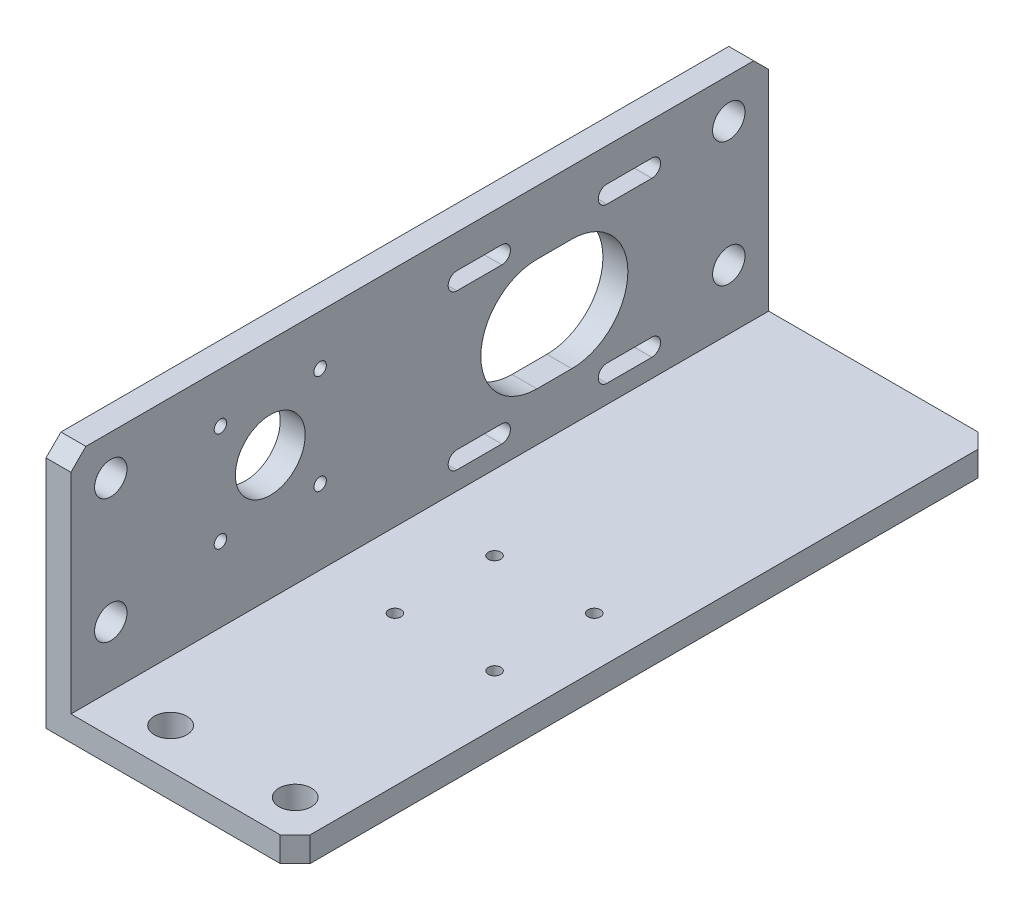
from build123d import *

# Parameters (mm, degrees)
ESTRUSIONE_ESTRUSIONE1_DEPTH = 140
FORO_6_5_6_5_1_D             = 6.5
FORO_6_5_6_5_2_AT_2_COUNT    = 2
FORO_6_5_6_5_2_AT_2_PITCH    = 25
TAGLIO_ESTRUSIONE2_REACH     = 158.844
SCHIZZO9_R                   = 7
TAGLIO_ESTRUSIONE4_REACH     = 158.844
SMUSSO1_SIZE                 = 3
M3_TAPPED_HOLE1_D            = 2.5
M3_TAPPED_HOLE2_D            = 2.5


with BuildPart() as part:
    # Schizzo1 → Estrusione-Estrusione1 (new body)
    with BuildSketch(Plane.XY):
        Polygon((0, 0), (0, 50), (5, 50), (5, 5), (50, 5), (50, 0), align=None)
    extrude(amount=ESTRUSIONE_ESTRUSIONE1_DEPTH)

    # Foro Ø6.5 (6.5)-1 (through all)
    with Locations(Plane(origin=(0, 0, 0), x_dir=(-1, 0, 0), z_dir=(0, -1, 0))):
        with Locations((-17, -132), (-42, -132)):
            Hole(FORO_6_5_6_5_1_D / 2)

    # Schizzo6 → Foro Ø6.5 (6.5)-2 (revolve, cut)
    with BuildSketch(Plane(origin=(0, 42, 132), x_dir=(0, 0, 1), z_dir=(0, 1, 0))):
        Polygon((0, 0), (0, 6.952797012), (3.25, 5), (3.25, 0), align=None)
    foro_6_5_6_5_2 = revolve(axis=Axis((-6.35, 42, 132), (1, 0, 0)), mode=Mode.SUBTRACT)

    # Foro Ø6.5 (6.5)-2 at 2: Foro Ø6.5 (6.5)-2 ×2
    with Locations(*[(0, -i * FORO_6_5_6_5_2_AT_2_PITCH, 0) for i in range(1, FORO_6_5_6_5_2_AT_2_COUNT)]):
        add(foro_6_5_6_5_2, mode=Mode.SUBTRACT)

    # Specchia1: Foro Ø6.5 (6.5)-2 across plane
    add(foro_6_5_6_5_2.mirror(Plane.XY.offset(70)), mode=Mode.SUBTRACT)

    # Specchia1 copy 1 sketch → Specchia1 copy 1 (revolve, cut)
    with BuildSketch(Plane(origin=(0, 17, 8), x_dir=(0, 0, -1), z_dir=(0, 1, 0))):
        Polygon((0, 0), (0, -6.952797012), (3.25, -5), (3.25, 0), align=None)
    revolve(axis=Axis((-6.35, 17, 8), (-1, 0, 0)), mode=Mode.SUBTRACT)

    # Schizzo9 → Taglio-Estrusione2 (cut, up to next)
    with BuildSketch(Plane.ZY, mode=Mode.PRIVATE) as taglio_estrusione2_sk1:
        with Locations((100, 30)):
            Circle(SCHIZZO9_R)
    taglio_estrusione2_tool1 = extrude(taglio_estrusione2_sk1.sketch, amount=-TAGLIO_ESTRUSIONE2_REACH, mode=Mode.PRIVATE) & part.part
    add(taglio_estrusione2_tool1.solids().sort_by_distance((0, 30, 100))[0], mode=Mode.SUBTRACT)

    # Schizzo11 → Taglio-Estrusione4 (cut, up to next)
    with BuildSketch(Plane.ZY, mode=Mode.PRIVATE) as taglio_estrusione4_sk1:
        with BuildLine():
            Line((62.556349186, 39.806349186), (53.556349186, 39.806349186))
            ThreePointArc((53.556349186, 39.806349186), (51.806349186, 41.556349186), (53.556349186, 43.306349186))
            Line((53.556349186, 43.306349186), (62.556349186, 43.306349186))
            ThreePointArc((62.556349186, 43.306349186), (64.306349186, 41.556349186), (62.556349186, 39.806349186))
        make_face()
    taglio_estrusione4_tool1 = extrude(taglio_estrusione4_sk1.sketch, amount=-TAGLIO_ESTRUSIONE4_REACH, mode=Mode.PRIVATE) & part.part
    # Schizzo11 → Taglio-Estrusione4 (cut, up to next)
    with BuildSketch(Plane.ZY, mode=Mode.PRIVATE) as taglio_estrusione4_sk2:
        with BuildLine():
            Line((62.556349186, 12.193650814), (53.556349186, 12.193650814))
            ThreePointArc((53.556349186, 12.193650814), (51.806349186, 10.443650814), (53.556349186, 8.693650814))
            Line((53.556349186, 8.693650814), (62.556349186, 8.693650814))
            ThreePointArc((62.556349186, 8.693650814), (64.306349186, 10.443650814), (62.556349186, 12.193650814))
        make_face()
    taglio_estrusione4_tool2 = extrude(taglio_estrusione4_sk2.sketch, amount=-TAGLIO_ESTRUSIONE4_REACH, mode=Mode.PRIVATE) & part.part
    # Schizzo11 → Taglio-Estrusione4 (cut, up to next)
    with BuildSketch(Plane.ZY, mode=Mode.PRIVATE) as taglio_estrusione4_sk3:
        with BuildLine():
            Line((23.443650814, 12.193650814), (32.443650814, 12.193650814))
            ThreePointArc((32.443650814, 12.193650814), (34.193650814, 10.443650814), (32.443650814, 8.693650814))
            Line((32.443650814, 8.693650814), (23.443650814, 8.693650814))
            ThreePointArc((23.443650814, 8.693650814), (21.693650814, 10.443650814), (23.443650814, 12.193650814))
        make_face()
    taglio_estrusione4_tool3 = extrude(taglio_estrusione4_sk3.sketch, amount=-TAGLIO_ESTRUSIONE4_REACH, mode=Mode.PRIVATE) & part.part
    # Schizzo11 → Taglio-Estrusione4 (cut, up to next)
    with BuildSketch(Plane.ZY, mode=Mode.PRIVATE) as taglio_estrusione4_sk4:
        with BuildLine():
            Line((23.443650814, 39.806349186), (32.443650814, 39.806349186))
            ThreePointArc((32.443650814, 39.806349186), (34.193650814, 41.556349186), (32.443650814, 43.306349186))
            Line((32.443650814, 43.306349186), (23.443650814, 43.306349186))
            ThreePointArc((23.443650814, 43.306349186), (21.693650814, 41.556349186), (23.443650814, 39.806349186))
        make_face()
    taglio_estrusione4_tool4 = extrude(taglio_estrusione4_sk4.sketch, amount=-TAGLIO_ESTRUSIONE4_REACH, mode=Mode.PRIVATE) & part.part
    # Schizzo11 → Taglio-Estrusione4 (cut, up to next)
    with BuildSketch(Plane.ZY, mode=Mode.PRIVATE) as taglio_estrusione4_sk5:
        with BuildLine():
            Line((46.5, 14.75), (39.5, 14.75))
            ThreePointArc((39.5, 14.75), (28.25, 26), (39.5, 37.25))
            Line((39.5, 37.25), (46.5, 37.25))
            ThreePointArc((46.5, 37.25), (57.75, 26), (46.5, 14.75))
        make_face()
    taglio_estrusione4_tool5 = extrude(taglio_estrusione4_sk5.sketch, amount=-TAGLIO_ESTRUSIONE4_REACH, mode=Mode.PRIVATE) & part.part
    add(taglio_estrusione4_tool1.solids().sort_by_distance((0, 41.556349, 58.056349))[0], mode=Mode.SUBTRACT)
    add(taglio_estrusione4_tool2.solids().sort_by_distance((0, 10.443651, 58.056349))[0], mode=Mode.SUBTRACT)
    add(taglio_estrusione4_tool3.solids().sort_by_distance((0, 10.443651, 27.943651))[0], mode=Mode.SUBTRACT)
    add(taglio_estrusione4_tool4.solids().sort_by_distance((0, 41.556349, 27.943651))[0], mode=Mode.SUBTRACT)
    add(taglio_estrusione4_tool5.solids().sort_by_distance((0, 26, 43))[0], mode=Mode.SUBTRACT)

    # Smusso1
    smusso1_edges = [part.edges().sort_by_distance(p)[0] for p in [
        (50, 2.5, 0),
        (2.5, 50, 0),
        (2.5, 50, 140),
        (50, 2.5, 140),
    ]]
    chamfer(smusso1_edges, length=SMUSSO1_SIZE)

    # M3 Tapped Hole1 (through all)
    with Locations(Plane(origin=(0, 40, 90), x_dir=(0, 0, -1), z_dir=(-1, 0, 0))):
        with Locations((0, 0), (-20, 0), (-20, 20), (0, 20)):
            Hole(M3_TAPPED_HOLE1_D / 2)

    # M3 Tapped Hole2 (through all)
    with Locations(Plane(origin=(20, 0, 90), x_dir=(-1, 0, 0), z_dir=(0, -1, 0))):
        with Locations((0, 0), (-20, 0), (-20, 20), (0, 20)):
            Hole(M3_TAPPED_HOLE2_D / 2)


solid = part.part
